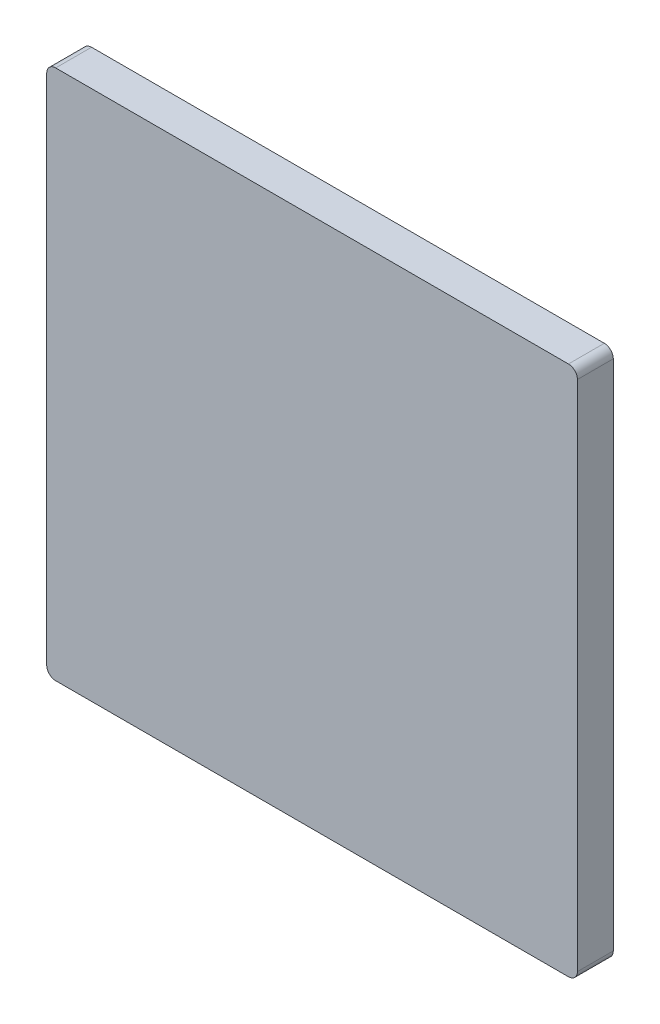
from build123d import *

# Parameters (mm, degrees)
BOSS_EXTRUDE1_DEPTH = 3.175


with BuildPart() as part:
    # Sketch1 → Boss-Extrude1 (new body)
    with BuildSketch(Plane.XY):
        with BuildLine():
            Line((22.70125, -23.495), (-22.70125, -23.495))
            ThreePointArc((-22.70125, -23.495), (-23.262516008, -23.262516008), (-23.495, -22.70125))
            Line((-23.495, -22.70125), (-23.495, 22.70125))
            ThreePointArc((-23.495, 22.70125), (-23.262516008, 23.262516008), (-22.70125, 23.495))
            Line((-22.70125, 23.495), (22.70125, 23.495))
            ThreePointArc((22.70125, 23.495), (23.262516008, 23.262516008), (23.495, 22.70125))
            Line((23.495, 22.70125), (23.495, -22.70125))
            ThreePointArc((23.495, -22.70125), (23.262516008, -23.262516008), (22.70125, -23.495))
        make_face()
    extrude(amount=BOSS_EXTRUDE1_DEPTH)


solid = part.part
